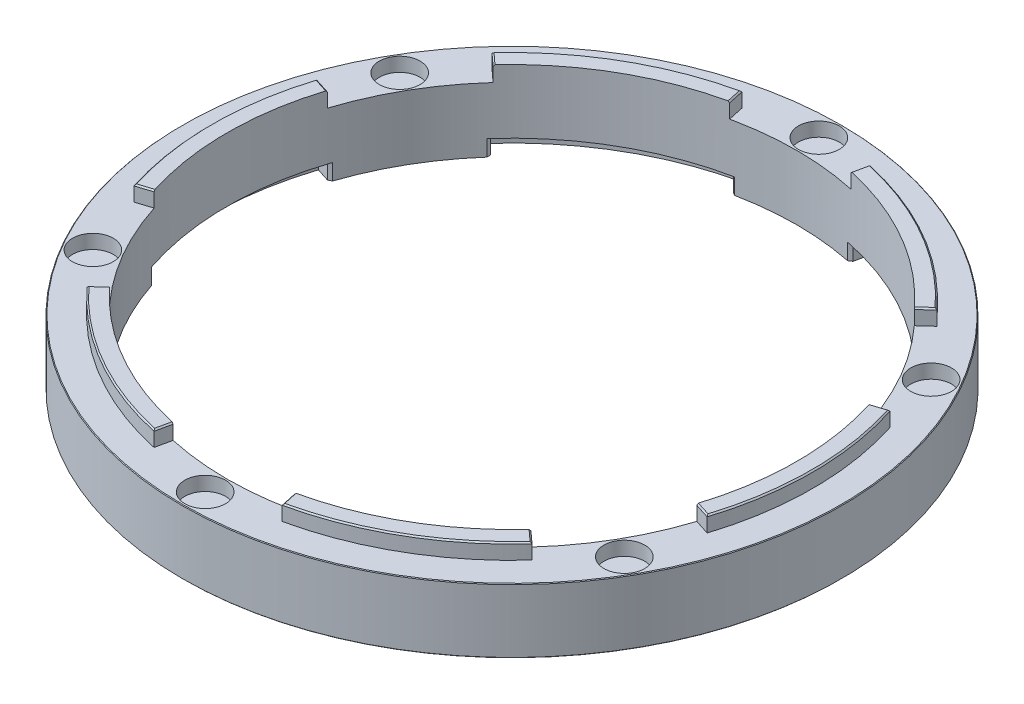
from build123d import *
from build123d.topology import SkipClean

# Parameters (mm, degrees)
SKETCH_1_W          = 3.35
SKETCH_1_H          = 4.82
SKETCH_2_R          = 1.525
CUT_EXTRUDE_1_DEPTH = 1.05
SKETCH_3_W          = 4
SKETCH_3_H          = 0.5
CUT_EXTRUDE_2_DEPTH = 1.2
EXTRUDE_1_DEPTH     = 1.15
CHAMFER_1_SIZE      = 0.1
CHAMFER_2_SIZE      = 0.05
CHAMFER_3_SIZE      = 0.2
CUT_EXTRUDE_START   = -1.05
SKETCH_6_R          = 1.525
CUT_EXTRUDE_3_DEPTH = 1.05


with BuildPart() as part:
    # 草图1 → 旋转1 (revolve)
    with BuildSketch(Plane.XY):
        with Locations((-22.975, -2.41)):
            Rectangle(SKETCH_1_W, SKETCH_1_H)
    revolve(axis=Axis((0, 0.266506915, 0), (0, 1, 0)))

    # 草图2 → 切除-拉伸1 (cut)
    with BuildSketch(Plane.XZ.offset(4.82)):
        with Locations((19.875283017, 11.475)):
            Circle(SKETCH_2_R)
        with Locations((19.875283017, -11.475)):
            Circle(SKETCH_2_R)
        with Locations((-19.875283017, -11.475)):
            Circle(SKETCH_2_R)
        with Locations((-19.875283017, 11.475)):
            Circle(SKETCH_2_R)
        with Locations((0, 22.95)):
            Circle(SKETCH_2_R)
        with Locations((0, -22.95)):
            Circle(SKETCH_2_R)
    extrude(amount=-CUT_EXTRUDE_1_DEPTH, mode=Mode.SUBTRACT)

    # 草图3 → 切除-拉伸2 (cut)
    with BuildSketch(Plane.XZ.offset(4.82)):
        with BuildLine():
            Line((-16.757915815, 15.088895173), (-15.828984783, 14.252481915))
            ThreePointArc((-15.828984783, 14.252481915), (-10.65, 18.446341101), (-4.428519014, 20.834543896))
            Line((-4.428519014, 20.834543896), (-4.688408628, 22.057228397))
            ThreePointArc((-4.688408628, 22.057228397), (-11.275, 19.528872855), (-16.757915815, 15.088895173))
        make_face()
        with BuildLine():
            Line((4.688408628, 22.057228397), (4.428519014, 20.834543896))
            ThreePointArc((4.428519014, 20.834543896), (10.65, 18.446341101), (15.828984783, 14.252481915))
            Line((15.828984783, 14.252481915), (16.757915815, 15.088895173))
            ThreePointArc((16.757915815, 15.088895173), (11.275, 19.528872855), (4.688408628, 22.057228397))
        make_face()
        with BuildLine():
            Line((16.757915815, -15.088895173), (15.828984783, -14.252481915))
            ThreePointArc((15.828984783, -14.252481915), (10.65, -18.446341101), (4.428519014, -20.834543896))
            Line((4.428519014, -20.834543896), (4.688408628, -22.057228397))
            ThreePointArc((4.688408628, -22.057228397), (11.275, -19.528872855), (16.757915815, -15.088895173))
        make_face()
        with BuildLine():
            Line((21.446324442, 6.968333223), (20.257503797, 6.58206198))
            ThreePointArc((20.257503797, 6.58206198), (21.3, 0), (20.257503797, -6.58206198))
            Line((20.257503797, -6.58206198), (21.446324442, -6.968333223))
            ThreePointArc((21.446324442, -6.968333223), (22.55, 0), (21.446324442, 6.968333223))
        make_face()
        with BuildLine():
            Line((-21.446324442, -6.968333223), (-20.257503797, -6.58206198))
            ThreePointArc((-20.257503797, -6.58206198), (-21.3, 0), (-20.257503797, 6.58206198))
            Line((-20.257503797, 6.58206198), (-21.446324442, 6.968333223))
            ThreePointArc((-21.446324442, 6.968333223), (-22.55, 0), (-21.446324442, -6.968333223))
        make_face()
        with BuildLine():
            Line((-4.688408628, -22.057228397), (-4.428519014, -20.834543896))
            ThreePointArc((-4.428519014, -20.834543896), (-10.65, -18.446341101), (-15.828984783, -14.252481915))
            Line((-15.828984783, -14.252481915), (-16.757915815, -15.088895173))
            ThreePointArc((-16.757915815, -15.088895173), (-11.275, -19.528872855), (-4.688408628, -22.057228397))
        make_face()
        with Locations((0, -22.95)):
            Rectangle(SKETCH_3_W, SKETCH_3_H)
    extrude(amount=-CUT_EXTRUDE_2_DEPTH, mode=Mode.SUBTRACT)

    # 草图5 → 凸台-拉伸1 (add)
    with SkipClean():  # the faces are left unmerged after this step: merging them gives an invalid solid
        with BuildSketch(Plane(origin=(0, 0, 0), x_dir=(-1, 0, 0), z_dir=(0, 1, 0))):
            with BuildLine():
                Line((-16.641699637, 15.142781554), (-15.754142323, 14.335166538))
                ThreePointArc((-15.754142323, 14.335166538), (-10.65, 18.446341101), (-4.537547228, 20.811070735))
                Line((-4.537547228, 20.811070735), (-4.793183691, 21.983525425))
                ThreePointArc((-4.793183691, 21.983525425), (-11.25, 19.485571585), (-16.641699637, 15.142781554))
            make_face()
            with BuildLine():
                Line((4.793183691, 21.983525425), (4.537547228, 20.811070735))
                ThreePointArc((4.537547228, 20.811070735), (10.65, 18.446341101), (15.754142323, 14.335166538))
                Line((15.754142323, 14.335166538), (16.641699637, 15.142781554))
                ThreePointArc((16.641699637, 15.142781554), (11.25, 19.485571585), (4.793183691, 21.983525425))
            make_face()
            with BuildLine():
                Line((16.639124698, -15.145610892), (15.751704714, -14.337844977))
                ThreePointArc((15.751704714, -14.337844977), (10.64686345, -18.448151633), (4.534008695, -20.811841945))
                Line((4.534008695, -20.811841945), (4.789445805, -21.984340083))
                ThreePointArc((4.789445805, -21.984340083), (11.246686743, -19.48748412), (16.639124698, -15.145610892))
            make_face()
            with BuildLine():
                Line((21.436046137, 6.83709924), (20.292790343, 6.472453947))
                ThreePointArc((20.292790343, 6.472453947), (21.299999692, -0.003621598), (20.290588172, -6.479354261))
                Line((20.290588172, -6.479354261), (21.4337199, -6.844388304))
                ThreePointArc((21.4337199, -6.844388304), (22.499999675, -0.003825632), (21.436046137, 6.83709924))
            make_face()
            with BuildLine():
                Line((-21.4337199, -6.844388304), (-20.290588172, -6.479354261))
                ThreePointArc((-20.290588172, -6.479354261), (-21.299999692, -0.003621598), (-20.292790343, 6.472453947))
                Line((-20.292790343, 6.472453947), (-21.436046137, 6.83709924))
                ThreePointArc((-21.436046137, 6.83709924), (-22.499999675, -0.003825632), (-21.4337199, -6.844388304))
            make_face()
            with BuildLine():
                Line((-4.789445805, -21.984340083), (-4.534008695, -20.811841945))
                ThreePointArc((-4.534008695, -20.811841945), (-10.64686345, -18.448151633), (-15.751704714, -14.337844977))
                Line((-15.751704714, -14.337844977), (-16.639124698, -15.145610892))
                ThreePointArc((-16.639124698, -15.145610892), (-11.246686743, -19.48748412), (-4.789445805, -21.984340083))
            make_face()
        extrude(amount=EXTRUDE_1_DEPTH)

    # 倒角1
    chamfer_1_edges = [part.edges().sort_by_distance(p)[0] for p in [
        (20.86441824, 1.15, 6.654776593),
        (20.862154036, 1.15, -6.661871283),
        (16.195414706, 1.15, -14.741727934),
        (4.66172725, 1.15, -21.398091014),
        (-4.66172725, 1.15, -21.398091014),
        (-16.195414706, 1.15, -14.741727934),
        (-20.862154036, 1.15, -6.661871283),
        (-20.86441824, 1.15, 6.654776593),
        (-16.19792098, 1.15, 14.738974046),
        (-4.665365459, 1.15, 21.39729808),
        (4.665365459, 1.15, 21.39729808),
        (16.19792098, 1.15, 14.738974046),
        (22.499999675, 1.15, -0.003825632),
        (11.246686743, 1.15, -19.48748412),
        (-11.246686743, 1.15, -19.48748412),
        (-22.499999675, 1.15, -0.003825632),
        (-11.25, 1.15, 19.485571585),
        (11.25, 1.15, 19.485571585),
    ]]
    chamfer(chamfer_1_edges, length=CHAMFER_1_SIZE)

    # 倒角2
    chamfer_2_edges = [part.edges().sort_by_distance(p)[0] for p in [
        (24.65, -4.82, 0),
        (24.65, 0, 0),
    ]]
    chamfer(chamfer_2_edges, length=CHAMFER_2_SIZE)

    # 倒角3
    chamfer_3_edges = [part.edges().sort_by_distance(p)[0] for p in [
        (-15.828984783, -4.22, 14.252481915),
        (-20.257503797, -4.22, 6.58206198),
        (-4.428519014, -4.22, 20.834543896),
        (4.428519014, -4.22, 20.834543896),
        (15.828984783, -4.22, 14.252481915),
        (-15.828984783, -4.22, -14.252481915),
        (-20.257503797, -4.22, -6.58206198),
        (-4.428519014, -4.22, -20.834543896),
        (4.428519014, -4.22, -20.834543896),
        (15.828984783, -4.22, -14.252481915),
        (20.257503797, -4.22, 6.58206198),
        (20.257503797, -4.22, -6.58206198),
    ]]
    chamfer(chamfer_3_edges, length=CHAMFER_3_SIZE)

    # 草图6 → 切除-拉伸3 (cut)
    with BuildSketch(Plane(origin=(0, 0, 0), x_dir=(-1, 0, 0), z_dir=(0, 1, 0)).offset(CUT_EXTRUDE_START)):
        with Locations((19.875283017, 11.475)):
            Circle(SKETCH_6_R)
        with Locations((19.875283017, -11.475)):
            Circle(SKETCH_6_R)
        with Locations((-19.875283017, -11.475)):
            Circle(SKETCH_6_R)
        with Locations((-19.875283017, 11.475)):
            Circle(SKETCH_6_R)
        with Locations((0, 22.95)):
            Circle(SKETCH_6_R)
        with Locations((0, -22.95)):
            Circle(SKETCH_6_R)
    extrude(amount=CUT_EXTRUDE_3_DEPTH, mode=Mode.SUBTRACT)


solid = part.part
